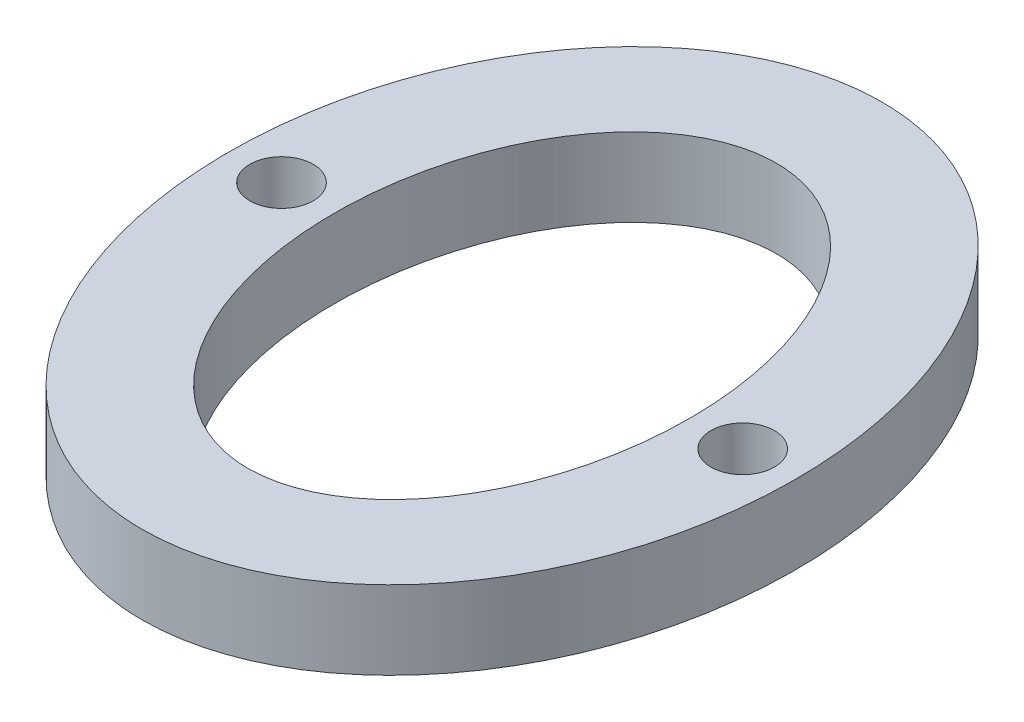
from build123d import *

# Parameters (mm, degrees)
SKETCH1_R           = 1.905
BOSS_EXTRUDE1_DEPTH = 4.7117


with BuildPart() as part:
    # Sketch1 → Boss-Extrude1 (new body)
    with BuildSketch(Plane(origin=(0, 0, 0), x_dir=(1, 0, 0), z_dir=(0, 1, 0))):
        with BuildLine():
            add(Edge.make_bspline(
                [(-13.85, -22.225), (3.175, -22.225), (3.175, 0)],
                knots=[0, 0, 0, 1.570796327, 1.570796327, 1.570796327], degree=2, weights=[1, 0.707106781, 1]))
            add(Edge.make_bspline(
                [(3.175, 0), (3.175, 22.22500004), (-13.85000003, 22.225), (-30.875000061, 22.22499996), (-30.875, -7.9e-08)],
                knots=[1.570796327, 1.570796327, 1.570796327, 3.141592655, 3.141592655, 4.712388984, 4.712388984, 4.712388984], degree=2, weights=[1, 0.707106781, 1, 0.707106781, 1]))
            add(Edge.make_bspline(
                [(-30.875, -7.9e-08), (-30.874999939, -22.225), (-13.85, -22.225)],
                knots=[4.712388984, 4.712388984, 4.712388984, 6.283185307, 6.283185307, 6.283185307], degree=2, weights=[1, 0.707106782, 1]))
        make_face()
        with Locations((-27.7, 0)):
            Circle(SKETCH1_R, mode=Mode.SUBTRACT)
        with BuildLine():
            add(Edge.make_bspline(
                [(-24.525, 0), (-24.525, -15.875), (-13.85, -15.875)],
                knots=[4.71238898, 4.71238898, 4.71238898, 6.283185307, 6.283185307, 6.283185307], degree=2, weights=[1, 0.707106781, 1]))
            add(Edge.make_bspline(
                [(-3.175, -5e-09), (-3.174999996, 15.874999997), (-13.849999998, 15.875), (-24.525, 15.875000003), (-24.525, 0)],
                knots=[1.570796326, 1.570796326, 1.570796326, 3.141592653, 3.141592653, 4.71238898, 4.71238898, 4.71238898], degree=2, weights=[1, 0.707106781, 1, 0.707106781, 1]))
            add(Edge.make_bspline(
                [(-13.85, -15.875), (-3.175000004, -15.875), (-3.175, -5e-09)],
                knots=[0, 0, 0, 1.570796326, 1.570796326, 1.570796326], degree=2, weights=[1, 0.707106781, 1]))
        make_face(mode=Mode.SUBTRACT)
        Circle(SKETCH1_R, mode=Mode.SUBTRACT)
    extrude(amount=BOSS_EXTRUDE1_DEPTH)


solid = part.part
